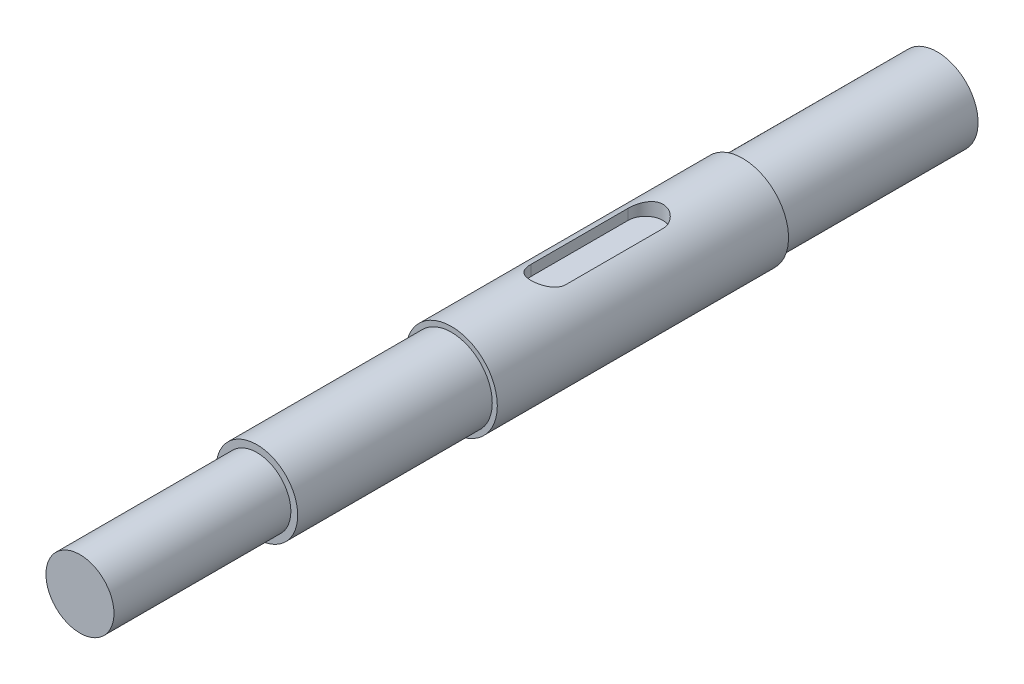
from build123d import *
from OCP.BRepAlgoAPI import BRepAlgoAPI_Cut
from OCP.TopTools import TopTools_ListOfShape

# Parameters (mm, degrees)
EXTRUDE_START       = -0.238871
SKETCH_1_R          = 3.37
EXTRUDE_1_DEPTH     = 50.000001
EXTRUDE_START_2     = 21.199419
EXTRUDE_2_DEPTH     = 7.123452
SKETCH_3_R          = 3.37
EXTRUDE_3_DEPTH     = 13
CUT_EXTRUDE_START   = -13
SKETCH_4_R          = 3.37
SKETCH_4_R_2        = 2.5
CUT_EXTRUDE_1_DEPTH = 13
CUT_EXTRUDE_START_2 = -14.3
SKETCH_5_R          = 3.37
SKETCH_5_R_2        = 3
CUT_EXTRUDE_2_DEPTH = 14.3
SKETCH_6_R          = 3.37
SKETCH_6_R_2        = 3
CUT_EXTRUDE_3_DEPTH = 14.3
CUT_EXTRUDE_4_DEPTH = 2


with BuildPart() as part:
    # 草图1 → 凸台-拉伸1 (new body)
    with BuildSketch(Plane.XY.offset(EXTRUDE_START)):
        with Locations(Location((0, 0, 0), (0, 0, 180))):
            Circle(SKETCH_1_R)
    extrude(amount=EXTRUDE_1_DEPTH)

    # 草图2 → 凸台-拉伸2 (add)
    with BuildSketch(Plane.XY.offset(EXTRUDE_START_2)):
        with BuildLine():
            Line((-1.286694662, 4.34), (1.286694662, 4.34))
            Line((1.286694662, 4.34), (1.286694662, 3.1146937))
            ThreePointArc((1.286694662, 3.1146937), (0, -3.37), (-1.286694662, 3.1146937))
            Line((-1.286694662, 3.1146937), (-1.286694662, 4.34))
        make_face()
    extrude(amount=EXTRUDE_2_DEPTH)

    # 草图3 → 凸台-拉伸3 (add)
    with BuildSketch(Plane.XY.offset(49.761129495)):
        with Locations(Location((0, 0, 0), (0, 0, 180))):
            Circle(SKETCH_3_R)
    extrude(amount=EXTRUDE_3_DEPTH)

    # 草图4 → 切除-拉伸1 (cut)
    with BuildSketch(Plane.XY.offset(62.761129495).offset(CUT_EXTRUDE_START)):
        with Locations(Location((0, 0, 0), (0, 0, 180))):
            Circle(SKETCH_4_R)
        Circle(SKETCH_4_R_2, mode=Mode.SUBTRACT)
    extrude(amount=CUT_EXTRUDE_1_DEPTH, mode=Mode.SUBTRACT)

    # 草图5 → 切除-拉伸2 (cut)
    with BuildSketch(Plane.XY.offset(49.761129495).offset(CUT_EXTRUDE_START_2)):
        with Locations(Location((0, 0, 0), (0, 0, 180))):
            Circle(SKETCH_5_R)
        Circle(SKETCH_5_R_2, mode=Mode.SUBTRACT)
    extrude(amount=CUT_EXTRUDE_2_DEPTH, mode=Mode.SUBTRACT)


with BuildPart() as cut_extrude_3_tool:
    # 草图6 → 切除-拉伸3 (new body)
    with BuildSketch(Plane(origin=(0, 0, -0.238870505), x_dir=(-1, 0, 0), z_dir=(0, 0, -1))):
        Circle(SKETCH_6_R)
        with Locations(Location((0, 0, 0), (0, 0, 180))):
            Circle(SKETCH_6_R_2, mode=Mode.SUBTRACT)
    extrude(amount=-CUT_EXTRUDE_3_DEPTH)


with BuildPart() as part_1:
    add(part.part)

    # 切除-拉伸3: cut by cut_extrude_3_tool, with a tolerance
    cut_extrude_3_stock = TopTools_ListOfShape()
    cut_extrude_3_stock.Append(part_1.part.wrapped)
    cut_extrude_3_tools = TopTools_ListOfShape()
    cut_extrude_3_tools.Append(cut_extrude_3_tool.part.wrapped)
    cut_extrude_3_cut = BRepAlgoAPI_Cut()
    cut_extrude_3_cut.SetArguments(cut_extrude_3_stock)
    cut_extrude_3_cut.SetTools(cut_extrude_3_tools)
    cut_extrude_3_cut.SetFuzzyValue(0.00001)
    cut_extrude_3_cut.Build()
    add(Compound.cast(cut_extrude_3_cut.Shape()).solids(), mode=Mode.REPLACE)

    # 草图7 → 切除-拉伸4 (cut)
    with BuildSketch(Plane(origin=(0, 4.34, 0), x_dir=(1, 0, 0), z_dir=(0, 1, 0))):
        with BuildLine():
            Line((-1.286694662, -28.322870736), (-1.286694662, -21.199418736))
            ThreePointArc((-1.286694662, -21.199418736), (0, -19.912724074), (1.286694662, -21.199418736))
            Line((1.286694662, -21.199418736), (1.286694662, -28.322870736))
            ThreePointArc((1.286694662, -28.322870736), (0, -29.609565398), (-1.286694662, -28.322870736))
        make_face()
    extrude(amount=-CUT_EXTRUDE_4_DEPTH, mode=Mode.SUBTRACT)


solid = part_1.part
